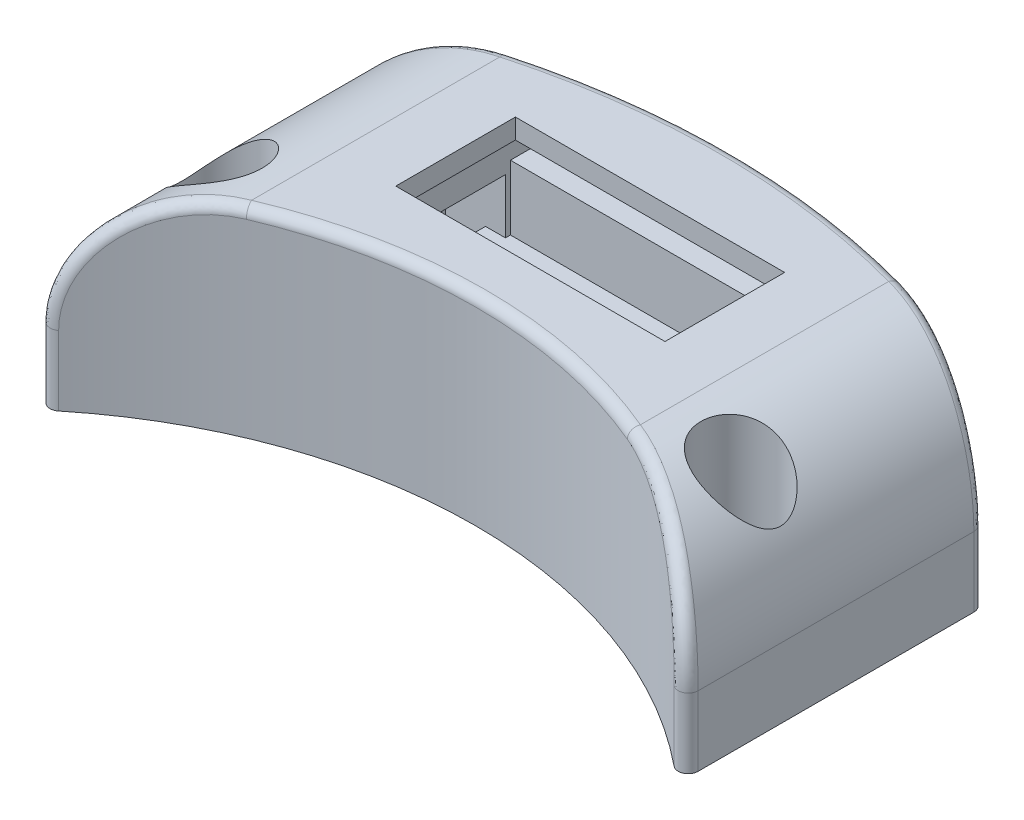
from build123d import *

# Parameters (mm, degrees)
SKETCH1_W               = 30
SKETCH1_H               = 21
BOSS_EXTRUDE1_DEPTH     = 20
SKETCH4_W               = 30
SKETCH4_H               = 21
SKETCH4_W_2             = 27
SKETCH4_H_2             = 12
BOSS_EXTRUDE2_DEPTH     = 2
CUT_EXTRUDE4_DEPTH      = 84.764663438
CUT_EXTRUDE4_DEPTH_BACK = 84.764663438
SKETCH7_R               = 2
SKETCH8_R               = 4
CUT_EXTRUDE5_DEPTH      = 17
FILLET1_START           = -74.567210226
FILLET1_DEPTH           = 38.567210226
FILLET2_R               = 1
SKETCH9_W               = 42
SKETCH9_H               = 13
CUT_EXTRUDE6_DEPTH      = 14
SKETCH10_W              = 29
SKETCH10_H              = 3.5
BOSS_EXTRUDE3_DEPTH     = 15.5
BOSS_EXTRUDE3_2_DEPTH   = 15.5
BOSS_EXTRUDE4_DEPTH     = 9
SKETCH12_W              = 4
SKETCH12_H              = 12
CUT_EXTRUDE7_DEPTH      = 7
SKETCH18_W              = 6
SKETCH18_H              = 6
CUT_EXTRUDE8_DEPTH      = 21.5
CUT_EXTRUDE10_DEPTH     = 5


with BuildPart() as part:
    # Sketch1 → Boss-Extrude1 (new body)
    with BuildSketch(Plane(origin=(0, 0, 0), x_dir=(1, 0, 0), z_dir=(0, 1, 0))):
        with BuildLine():
            Line((-32.5, 67.111987312), (-32.5, 36.670833097))
            ThreePointArc((-32.5, 36.670833097), (0, 49), (32.5, 36.670833097))
            Line((32.5, 36.670833097), (32.5, 67.111987312))
            ThreePointArc((32.5, 67.111987312), (0, 74.567210226), (-32.5, 67.111987312))
        make_face()
        with Locations((0, 60.5)):
            Rectangle(SKETCH1_W, SKETCH1_H, mode=Mode.SUBTRACT)
    extrude(amount=BOSS_EXTRUDE1_DEPTH)

    # Sketch4 → Boss-Extrude2 (add)
    with BuildSketch(Plane(origin=(0, 20, 0), x_dir=(1, 0, 0), z_dir=(0, 1, 0))):
        with Locations((0, 60.5)):
            Rectangle(SKETCH4_W, SKETCH4_H)
        with Locations((0, 60.5)):
            Rectangle(SKETCH4_W_2, SKETCH4_H_2, mode=Mode.SUBTRACT)
    extrude(amount=-BOSS_EXTRUDE2_DEPTH)

    # Sketch7 → Cut-Extrude4 (cut, two sides: drawn at the far end of the back side and taken through both)
    with BuildSketch(Plane.XZ.offset(-CUT_EXTRUDE4_DEPTH_BACK)):
        with Locations(Location((-26, -49.598387071, 0), (0, 0, 270))):
            Circle(SKETCH7_R)
        with Locations(Location((26, -49.598387071, 0), (0, 0, 270))):
            Circle(SKETCH7_R)
    extrude(amount=CUT_EXTRUDE4_DEPTH + CUT_EXTRUDE4_DEPTH_BACK, mode=Mode.SUBTRACT)

    # Sketch8 → Cut-Extrude5 (cut)
    with BuildSketch(Plane(origin=(0, 20, 0), x_dir=(1, 0, 0), z_dir=(0, 1, 0))):
        with Locations(Location((-26, 49.598387071, 0), (0, 0, 270))):
            Circle(SKETCH8_R)
        with Locations(Location((26, 49.598387071, 0), (0, 0, 270))):
            Circle(SKETCH8_R)
    extrude(amount=-CUT_EXTRUDE5_DEPTH, mode=Mode.SUBTRACT)

    # Fillet1: read off the stored shape, not the designer's step
    # Fillet1 outline → Fillet1 (cut)
    with BuildSketch(Plane.XY.offset(FILLET1_START)):
        with BuildLine():
            ThreePointArc((-32.5, 7), (-28.692388155, 16.192388155), (-19.5, 20))
            Line((-19.5, 20), (-32.5, 20))
            Line((-32.5, 20), (-32.5, 7))
        make_face()
        with BuildLine():
            ThreePointArc((19.5, 20), (28.692388155, 16.192388155), (32.5, 7))
            Line((32.5, 7), (32.5, 20))
            Line((32.5, 20), (19.5, 20))
        make_face()
    extrude(amount=FILLET1_DEPTH, mode=Mode.SUBTRACT)

    # Fillet2
    fillet2_edges = [part.edges().sort_by_distance(p)[0] for p in [
        (0, 20, -74.567210226),
        (0, 20, -49),
        (-32.5, 3.5, -67.111987312),
        (32.5, 3.5, -67.111987312),
        (-29.245019007, 15.604336324, -68.592985841),
        (29.244875325, 15.604499052, -68.593047101),
        (32.5, 3.5, -36.670833097),
        (-32.5, 3.5, -36.670833097),
        (-28.985800865, 15.889295919, -39.507256911),
        (29.001453171, 15.872563758, -39.49576831),
    ]]
    fillet(fillet2_edges, radius=FILLET2_R - 0.0001)  # a hair under: the kernel refuses the full size

    # Sketch9 → Cut-Extrude6 (cut)
    with BuildSketch(Plane.XZ):
        with Locations((0, -60.5)):
            Rectangle(SKETCH9_W, SKETCH9_H)
    extrude(amount=-CUT_EXTRUDE6_DEPTH, mode=Mode.SUBTRACT)


with BuildPart() as body_2:
    # Sketch10 → Boss-Extrude3 (new body)
    with BuildSketch(Plane.XZ):
        with Locations((0, -68.75)):
            Rectangle(SKETCH10_W, SKETCH10_H)
    extrude(amount=-BOSS_EXTRUDE3_DEPTH)



with BuildPart() as body_3:
    # Sketch10 → Boss-Extrude3 2 (new body)
    with BuildSketch(Plane.XZ):
        with Locations((0, -52.25)):
            Rectangle(SKETCH10_W, SKETCH10_H)
    extrude(amount=-BOSS_EXTRUDE3_2_DEPTH)


with BuildPart() as body_2_1:
    add(body_2.part)

    add(body_3.part)  # Boss-Extrude4 merges body 3
    # Sketch11 → Boss-Extrude4 (add)
    with BuildSketch(Plane.XZ):
        Polygon((-20.5, -66.5), (-14.5, -66.5), (-14.5, -67), (14.5, -67), (14.5, -66.5), (20.5, -66.5), (20.5, -54.5), (14.5, -54.5), (14.5, -54), (-14.5, -54), (-14.5, -54.5), (-20.5, -54.5), align=None)
    extrude(amount=-BOSS_EXTRUDE4_DEPTH)

    # Sketch12 → Cut-Extrude7 (cut)
    with BuildSketch(Plane(origin=(0, 9, 0), x_dir=(1, 0, 0), z_dir=(0, 1, 0))):
        with Locations((-18.5, 60.5)):
            Rectangle(SKETCH12_W, SKETCH12_H)
    extrude(amount=-CUT_EXTRUDE7_DEPTH, mode=Mode.SUBTRACT)

    # Sketch18 → Cut-Extrude8 (cut)
    with BuildSketch(Plane.ZY.offset(16.5)):
        with Locations((-60.5, 6)):
            Rectangle(SKETCH18_W, SKETCH18_H)
    extrude(amount=-CUT_EXTRUDE8_DEPTH, mode=Mode.SUBTRACT)


with BuildPart() as cut_extrude10_tool:
    # Sketch24 → Cut-Extrude10 (new, symmetric)
    with BuildSketch(Plane(origin=(0, 0, 0), x_dir=(0, 0, -1), z_dir=(1, 0, 0))):
        Polygon((49, 0), (56, 0), (60.5, 3), (57.5, 9), align=None)
    extrude(amount=CUT_EXTRUDE10_DEPTH, both=True)


with BuildPart() as part_1:
    add(part.part)

    # Cut-Extrude10: cut by cut_extrude10_tool
    add(cut_extrude10_tool.part, mode=Mode.SUBTRACT)


with BuildPart() as body_2_2:
    add(body_2_1.part)

    # Cut-Extrude10: cut by cut_extrude10_tool
    add(cut_extrude10_tool.part, mode=Mode.SUBTRACT)


solid = Compound([part_1.part, body_2_2.part])
